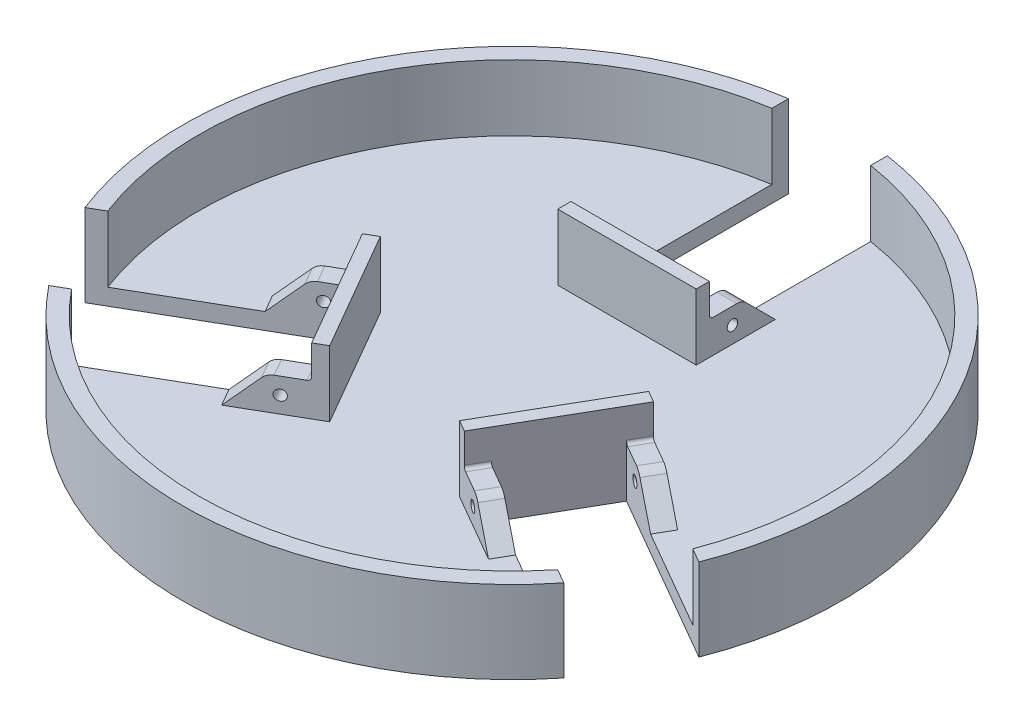
from build123d import *

# Parameters (mm, degrees)
AUFSATZ_LINEAR_AUSTRAGEN1_DEPTH = 5
SKIZZE2_W                       = 6
SKIZZE2_H                       = 10
AUFSATZ_LINEAR_AUSTRAGEN2_DEPTH = 10
FASE1_SIZE                      = 10
SKIZZE3_R                       = 1.6
SCHNITT_LINEAR_AUSTRAGEN1_DEPTH = 42
SKIZZE4_W                       = 42
SKIZZE4_H                       = 4
AUFSATZ_LINEAR_AUSTRAGEN3_DEPTH = 20
KREISMUSTER1_COUNT              = 3
VERRUNDUNG1_START               = -21
VERRUNDUNG1_DEPTH               = 6
VERRUNDUNG1_START_2             = 15
VERRUNDUNG1_2_DEPTH             = 6
VERRUNDUNG1_3_DEPTH             = 6
VERRUNDUNG1_4_DEPTH             = 6
VERRUNDUNG1_5_DEPTH             = 6
VERRUNDUNG1_6_DEPTH             = 6
VERRUNDUNG1_START_3             = -22
VERRUNDUNG1_7_DEPTH             = 44
VERRUNDUNG1_8_DEPTH             = 44
VERRUNDUNG1_9_DEPTH             = 44


with BuildPart() as part:
    # Skizze1 → Aufsatz-Linear austragen1 (new body)
    with BuildSketch(Plane(origin=(0, 0, 0), x_dir=(1, 0, 0), z_dir=(0, 1, 0))):
        with BuildLine():
            Line((93.122718948, -36.443918776), (41.161194721, -6.443918776))
            Line((41.161194721, -6.443918776), (26.161194721, -32.42468089))
            Line((26.161194721, -32.42468089), (78.122718948, -62.42468089))
            ThreePointArc((78.122718948, -62.42468089), (0, -100), (-78.122718948, -62.42468089))
            Line((-78.122718948, -62.42468089), (-26.161194721, -32.42468089))
            Line((-26.161194721, -32.42468089), (-41.161194721, -6.443918776))
            Line((-41.161194721, -6.443918776), (-93.122718948, -36.443918776))
            ThreePointArc((-93.122718948, -36.443918776), (-86.602540378, 50), (-15, 98.868599666))
            Line((-15, 98.868599666), (-15, 38.868599666))
            Line((-15, 38.868599666), (15, 38.868599666))
            Line((15, 38.868599666), (15, 98.868599666))
            ThreePointArc((15, 98.868599666), (86.602540378, 50), (93.122718948, -36.443918776))
        make_face()
    extrude(amount=AUFSATZ_LINEAR_AUSTRAGEN1_DEPTH)

    # Skizze2 → Aufsatz-Linear austragen2 (add)
    with BuildSketch(Plane(origin=(0, 5, 0), x_dir=(1, 0, 0), z_dir=(0, 1, 0))):
        Polygon((49.821448758, -11.443918776), (52.821448758, -6.247766354), (44.161194721, -1.247766354), (41.161194721, -6.443918776), align=None)
        with Locations((-18, 43.868599666)):
            Rectangle(SKIZZE2_W, SKIZZE2_H)
        with Locations((18, 43.868599666)):
            Rectangle(SKIZZE2_W, SKIZZE2_H)
        Polygon((26.161194721, -32.42468089), (23.161194721, -37.620833313), (31.821448758, -42.620833313), (34.821448758, -37.42468089), align=None)
        Polygon((-34.821448758, -37.42468089), (-31.821448758, -42.620833313), (-23.161194721, -37.620833313), (-26.161194721, -32.42468089), align=None)
        Polygon((-41.161194721, -6.443918776), (-44.161194721, -1.247766354), (-52.821448758, -6.247766354), (-49.821448758, -11.443918776), align=None)
    extrude(amount=AUFSATZ_LINEAR_AUSTRAGEN2_DEPTH)

    # Fase1
    fase1_edges = [part.edges().sort_by_distance(p)[0] for p in [
        (-18, 5, -48.868599666),
        (18, 5, -48.868599666),
        (51.321448758, 5, 8.845842565),
        (33.321448758, 5, 40.022757101),
        (-33.321448758, 5, 40.022757101),
        (-51.321448758, 5, 8.845842565),
    ]]
    chamfer(fase1_edges, length=FASE1_SIZE - 0.0001)  # a hair under: the kernel refuses the full size

    # Skizze3 → Schnitt-Linear austragen1 (cut)
    with BuildSketch(Plane(origin=(10.5, 0, 18.186533479), x_dir=(0.8660254037844384, 0, -0.5000000000000007), z_dir=(0.5000000000000006, 0, 0.8660254037844383))):
        with Locations((-45.868599666, 10)):
            Circle(SKIZZE3_R)
    schnitt_linear_austragen1 = extrude(amount=-SCHNITT_LINEAR_AUSTRAGEN1_DEPTH, mode=Mode.SUBTRACT)

    # Skizze4 → Aufsatz-Linear austragen3 (add)
    with BuildSketch(Plane(origin=(0, 5, 0), x_dir=(1, 0, 0), z_dir=(0, 1, 0))):
        with BuildLine():
            Line((-93.122718948, -36.443918776), (-88.740384046, -33.913776541))
            ThreePointArc((-88.740384046, -33.913776541), (-82.27241336, 47.5), (-15, 93.808315196))
            Line((-15, 93.808315196), (-15, 98.868599666))
            ThreePointArc((-15, 98.868599666), (-86.602540378, 50), (-93.122718948, -36.443918776))
        make_face()
        with BuildLine():
            Line((-78.122718948, -62.42468089), (-73.740384046, -59.894538655))
            ThreePointArc((-73.740384046, -59.894538655), (0, -95), (73.740384046, -59.894538655))
            Line((73.740384046, -59.894538655), (78.122718948, -62.42468089))
            ThreePointArc((78.122718948, -62.42468089), (0, -100), (-78.122718948, -62.42468089))
        make_face()
        with BuildLine():
            Line((93.122718948, -36.443918776), (88.740384046, -33.913776541))
            ThreePointArc((88.740384046, -33.913776541), (82.27241336, 47.5), (15, 93.808315196))
            Line((15, 93.808315196), (15, 98.868599666))
            ThreePointArc((15, 98.868599666), (86.602540378, 50), (93.122718948, -36.443918776))
        make_face()
        Polygon((-44.161194721, -1.247766354), (-23.161194721, -37.620833313), (-19.697093106, -35.620833313), (-40.697093106, 0.752233646), align=None)
        with Locations((0, 36.868599666)):
            Rectangle(SKIZZE4_W, SKIZZE4_H)
        Polygon((19.697093106, -35.620833313), (40.697093106, 0.752233646), (44.161194721, -1.247766354), (23.161194721, -37.620833313), align=None)
    extrude(amount=AUFSATZ_LINEAR_AUSTRAGEN3_DEPTH)

    # Kreismuster1: Schnitt-Linear austragen1 ×3 about axis
    kreismuster1_axis = Axis((0, 5, 0), (0, -1, 0))
    for i in range(1, KREISMUSTER1_COUNT):
        add(schnitt_linear_austragen1.rotate(kreismuster1_axis, i * 360 / KREISMUSTER1_COUNT), mode=Mode.SUBTRACT)

    # Verrundung1: read off the stored shape, not the designer's step
    # Verrundung1 outline → Verrundung1 (add)
    with BuildSketch(Plane.YZ.offset(VERRUNDUNG1_START)):
        with BuildLine():
            ThreePointArc((15, -39.868599666), (15.292893219, -39.161492885), (16, -38.868599666))
            Line((16, -38.868599666), (15, -38.868599666))
            Line((15, -38.868599666), (15, -39.868599666))
        make_face()
    extrude(amount=VERRUNDUNG1_DEPTH)

    # Verrundung1 2 outline → Verrundung1 2 (add)
    with BuildSketch(Plane.YZ.offset(VERRUNDUNG1_START_2)):
        with BuildLine():
            ThreePointArc((15, -39.868599666), (15.292893219, -39.161492885), (16, -38.868599666))
            Line((16, -38.868599666), (15, -38.868599666))
            Line((15, -38.868599666), (15, -39.868599666))
        make_face()
    extrude(amount=VERRUNDUNG1_2_DEPTH)

    # Verrundung1 3 outline → Verrundung1 3 (add)
    with BuildSketch(Plane(origin=(0, 0, 0), x_dir=(0.8660254037844386, 0, 0.4999999999999999), z_dir=(0.4999999999999999, 0, -0.8660254037844388)).offset(VERRUNDUNG1_START)):
        with BuildLine():
            Line((38.868599666, -15), (38.868599666, -16))
            ThreePointArc((38.868599666, -16), (39.161492885, -15.292893219), (39.868599666, -15))
            Line((39.868599666, -15), (38.868599666, -15))
        make_face()
    extrude(amount=VERRUNDUNG1_3_DEPTH)

    # Verrundung1 4 outline → Verrundung1 4 (add)
    with BuildSketch(Plane(origin=(0, 0, 0), x_dir=(0.8660254037844386, 0, 0.4999999999999999), z_dir=(0.4999999999999999, 0, -0.8660254037844388)).offset(VERRUNDUNG1_START_2)):
        with BuildLine():
            Line((38.868599666, -15), (38.868599666, -16))
            ThreePointArc((38.868599666, -16), (39.161492885, -15.292893219), (39.868599666, -15))
            Line((39.868599666, -15), (38.868599666, -15))
        make_face()
    extrude(amount=VERRUNDUNG1_4_DEPTH)

    # Verrundung1 5 outline → Verrundung1 5 (add)
    with BuildSketch(Plane(origin=(0, 0, 0), x_dir=(0.8660254037844384, 0, -0.5000000000000003), z_dir=(0.5000000000000003, 0, 0.8660254037844385)).offset(VERRUNDUNG1_START)):
        with BuildLine():
            Line((-38.868599666, 15), (-38.868599666, 16))
            ThreePointArc((-38.868599666, 16), (-39.161492885, 15.292893219), (-39.868599666, 15))
            Line((-39.868599666, 15), (-38.868599666, 15))
        make_face()
    extrude(amount=VERRUNDUNG1_5_DEPTH)

    # Verrundung1 6 outline → Verrundung1 6 (add)
    with BuildSketch(Plane(origin=(0, 0, 0), x_dir=(0.8660254037844384, 0, -0.5000000000000003), z_dir=(0.5000000000000003, 0, 0.8660254037844385)).offset(VERRUNDUNG1_START_2)):
        with BuildLine():
            Line((-38.868599666, 15), (-38.868599666, 16))
            ThreePointArc((-38.868599666, 16), (-39.161492885, 15.292893219), (-39.868599666, 15))
            Line((-39.868599666, 15), (-38.868599666, 15))
        make_face()
    extrude(amount=VERRUNDUNG1_6_DEPTH)

    # Verrundung1 7 outline → Verrundung1 7 (cut)
    with BuildSketch(Plane.YZ.offset(VERRUNDUNG1_START_3)):
        with BuildLine():
            Line((15, -48.868599666), (15, -47.211745417))
            ThreePointArc((15, -47.211745417), (14.69551813, -48.742479146), (13.828427125, -50.040172542))
            Line((13.828427125, -50.040172542), (15, -48.868599666))
        make_face()
    extrude(amount=VERRUNDUNG1_7_DEPTH, mode=Mode.SUBTRACT)

    # Verrundung1 8 outline → Verrundung1 8 (cut)
    with BuildSketch(Plane(origin=(0, 0, 0), x_dir=(0.8660254037844386, 0, 0.4999999999999999), z_dir=(0.4999999999999999, 0, -0.8660254037844388)).offset(VERRUNDUNG1_START_3)):
        with BuildLine():
            ThreePointArc((50.040172542, -13.828427125), (48.742479146, -14.69551813), (47.211745417, -15))
            Line((47.211745417, -15), (48.868599666, -15))
            Line((48.868599666, -15), (50.040172542, -13.828427125))
        make_face()
    extrude(amount=VERRUNDUNG1_8_DEPTH, mode=Mode.SUBTRACT)

    # Verrundung1 9 outline → Verrundung1 9 (cut)
    with BuildSketch(Plane(origin=(0, 0, 0), x_dir=(0.8660254037844384, 0, -0.5000000000000003), z_dir=(0.5000000000000003, 0, 0.8660254037844385)).offset(VERRUNDUNG1_START_3)):
        with BuildLine():
            ThreePointArc((-50.040172542, 13.828427125), (-48.742479146, 14.69551813), (-47.211745417, 15))
            Line((-47.211745417, 15), (-48.868599666, 15))
            Line((-48.868599666, 15), (-50.040172542, 13.828427125))
        make_face()
    extrude(amount=VERRUNDUNG1_9_DEPTH, mode=Mode.SUBTRACT)


solid = part.part
